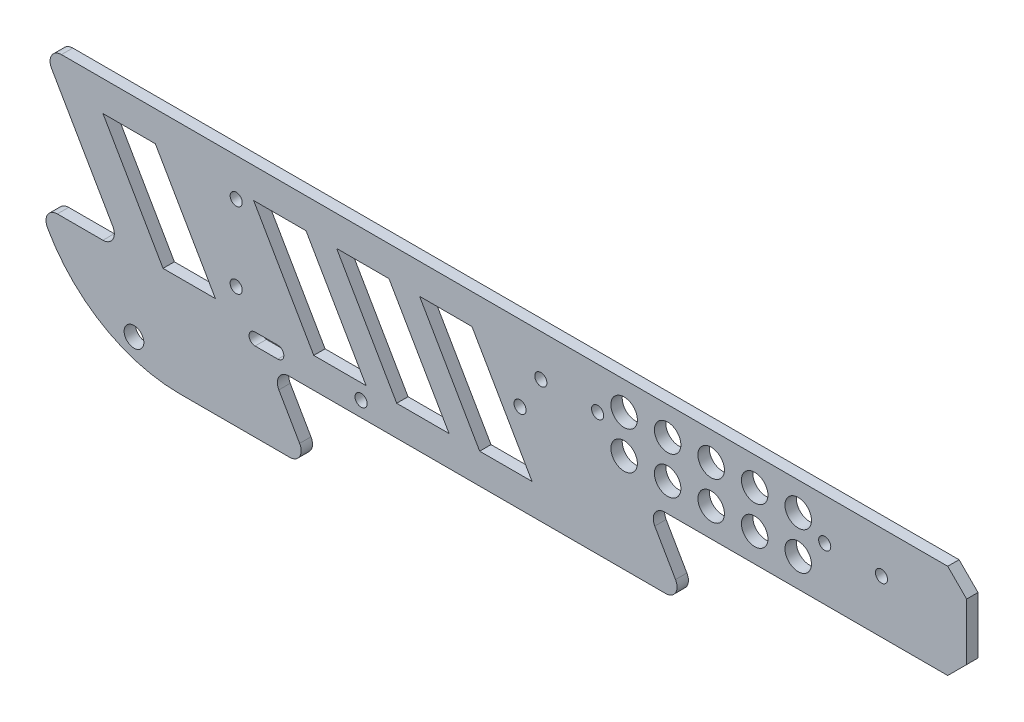
from build123d import *

# Parameters (mm, degrees)
SKETCH_1_W          = 245
SKETCH_1_H          = 62
SKETCH_1_R          = 1.6
SKETCH_1_R_2        = 2.6
EXTRUDE_1_DEPTH     = 1.5
SKETCH_2_R          = 1.6
CUT_EXTRUDE_1_DEPTH = 253.740974122
SKETCH_3_OUTSIDE_W  = 297.548
SKETCH_3_OUTSIDE_H  = 114.548
CUT_EXTRUDE_2_DEPTH = 3
FILLET_1_R          = 40
FILLET_2_R          = 3
CHAMFER_1_SIZE      = 5
SKETCH_4_R          = 3.5
CUT_EXTRUDE_3_DEPTH = 252.040549253
CUT_EXTRUDE_4_REACH = 253.041
SKETCH_5_R          = 1.6


with BuildPart() as part:
    # 草图1 → 凸台-拉伸1 (new, symmetric)
    with BuildSketch(Plane.XY):
        with Locations((-122.5, -31)):
            Rectangle(SKETCH_1_W, SKETCH_1_H)
        with Locations((-112.5, -11)):
            Circle(SKETCH_1_R, mode=Mode.SUBTRACT)
        with Locations((-37.5, -11)):
            Circle(SKETCH_1_R, mode=Mode.SUBTRACT)
        with Locations(Location((-97.5, -11, 0), (0, 0, 180))):
            Circle(SKETCH_1_R, mode=Mode.SUBTRACT)
        with Locations(Location((-22.5, -11, 0), (0, 0, 180))):
            Circle(SKETCH_1_R, mode=Mode.SUBTRACT)
        with Locations((-220, -55)):
            Circle(SKETCH_1_R_2, mode=Mode.SUBTRACT)
    extrude(amount=EXTRUDE_1_DEPTH, both=True)

    # 草图2 → 切除-拉伸1 (cut, through all)
    with BuildSketch(Plane.XY.offset(1.5)):
        with Locations((-193, -10)):
            Circle(SKETCH_2_R)
        with Locations((-193, -30)):
            Circle(SKETCH_2_R)
        with Locations((-118, -20)):
            Circle(SKETCH_2_R)
    extrude(amount=-CUT_EXTRUDE_1_DEPTH, mode=Mode.SUBTRACT)

    # 草图3 outside → 切除-拉伸2 (cut)
    with BuildSketch(Plane.XY.offset(1.5)):
        with Locations((-122.5, -31)):
            Rectangle(SKETCH_3_OUTSIDE_W, SKETCH_3_OUTSIDE_H)
        Polygon((0, 0), (-244.36195996, 0), (-223, -37), (-245, -37), (-245, -62), (-173.63804004, -62), (-184.31902002, -43.5), (-74.31902002, -43.5), (-85, -25), (0, -25), align=None, mode=Mode.SUBTRACT)
    extrude(amount=-CUT_EXTRUDE_2_DEPTH, mode=Mode.SUBTRACT)

    # 圆角1
    # the kernel refuses this fillet: 40 mm, written as the material it takes off along each edge
    with BuildSketch(Plane(origin=(-245, -62, -94.202481089), x_dir=(1, 0, 0), z_dir=(0, 0, 1))) as fillet_1_piece_1:
        with BuildLine():
            CenterArc((37.080992435, 40), FILLET_1_R, 202.024312837, 67.975687163)
            Line((0, 25), (-0.741619849, 24.7))
            ThreePointArc((-0.741619849, 24.7), (-0.8, 12.5), (-0.8, 0))
            Line((-0.8, 0), (0, -0.8))
            Line((0, -0.8), (37.080992435, -0.8))
            Line((37.080992435, -0.8), (37.080992435, 0))
        make_face()
    extrude(amount=188.404962177, mode=Mode.SUBTRACT)

    # 圆角2
    fillet_2_edges = [part.edges().sort_by_distance(p)[0] for p in [
        (-85, -25, 0),
        (-74.31902002, -43.5, 0),
        (-184.31902002, -43.5, 0),
        (-173.63804004, -62, 0),
        (-245, -37, 0),
        (-223, -37, 0),
        (-244.36195996, 0, 0),
    ]]
    fillet(fillet_2_edges, radius=FILLET_2_R)

    # 倒角1
    chamfer_1_edges = [part.edges().sort_by_distance(p)[0] for p in [
        (0, -25, 0),
        (0, 0, 0),
    ]]
    chamfer(chamfer_1_edges, length=CHAMFER_1_SIZE)

    # 草图4 → 切除-拉伸3 (cut, through all)
    with BuildSketch(Plane.XY.offset(1.5)):
        with Locations((-90.5, -7.5)):
            Circle(SKETCH_4_R)
        with Locations((-79, -7.5)):
            Circle(SKETCH_4_R)
        with Locations((-67.5, -7.5)):
            Circle(SKETCH_4_R)
        with Locations((-56, -7.5)):
            Circle(SKETCH_4_R)
        with Locations((-44.5, -7.5)):
            Circle(SKETCH_4_R)
        with Locations((-79, -17.5)):
            Circle(SKETCH_4_R)
        with Locations((-67.5, -17.5)):
            Circle(SKETCH_4_R)
        with Locations((-56, -17.5)):
            Circle(SKETCH_4_R)
        with Locations((-44.5, -17.5)):
            Circle(SKETCH_4_R)
        with Locations((-90.5, -17.5)):
            Circle(SKETCH_4_R)
        Polygon((-174.543303051, -8), (-188.381197846, -8), (-172.504065444, -35.5), (-158.666170648, -35.5), align=None)
        Polygon((-152.622504486, -8), (-166.460399282, -8), (-150.583266879, -35.5), (-136.745372084, -35.5), align=None)
        Polygon((-130.701705922, -8), (-144.539600718, -8), (-128.662468315, -35.5), (-114.824573519, -35.5), align=None)
        Polygon((-214.358257627, -8), (-228.196152423, -8), (-212.31902002, -35.5), (-198.481125224, -35.5), align=None)
    extrude(amount=-CUT_EXTRUDE_3_DEPTH, mode=Mode.SUBTRACT)

    # 草图5 → 切除-拉伸4 (cut, up to next)
    with BuildSketch(Plane.XY.offset(1.5), mode=Mode.PRIVATE) as cut_extrude_4_sk1:
        with Locations((-160.004065444, -39.5)):
            Circle(SKETCH_5_R)
    cut_extrude_4_tool1 = extrude(cut_extrude_4_sk1.sketch, amount=-CUT_EXTRUDE_4_REACH, mode=Mode.PRIVATE) & part.part
    # 草图5 → 切除-拉伸4 (cut, up to next)
    with BuildSketch(Plane.XY.offset(1.5), mode=Mode.PRIVATE) as cut_extrude_4_sk2:
        with BuildLine():
            Line((-188.004065444, -37.9), (-182.004065444, -37.9))
            ThreePointArc((-182.004065444, -37.9), (-180.404065444, -39.5), (-182.004065444, -41.1))
            Line((-182.004065444, -41.1), (-188.004065444, -41.1))
            ThreePointArc((-188.004065444, -41.1), (-189.604065444, -39.5), (-188.004065444, -37.9))
        make_face()
    cut_extrude_4_tool2 = extrude(cut_extrude_4_sk2.sketch, amount=-CUT_EXTRUDE_4_REACH, mode=Mode.PRIVATE) & part.part
    add(cut_extrude_4_tool1.solids().sort_by_distance((-160.004065, -39.5, 1.5))[0], mode=Mode.SUBTRACT)
    add(cut_extrude_4_tool2.solids().sort_by_distance((-185.004065, -39.5, 1.5))[0], mode=Mode.SUBTRACT)


solid = part.part
